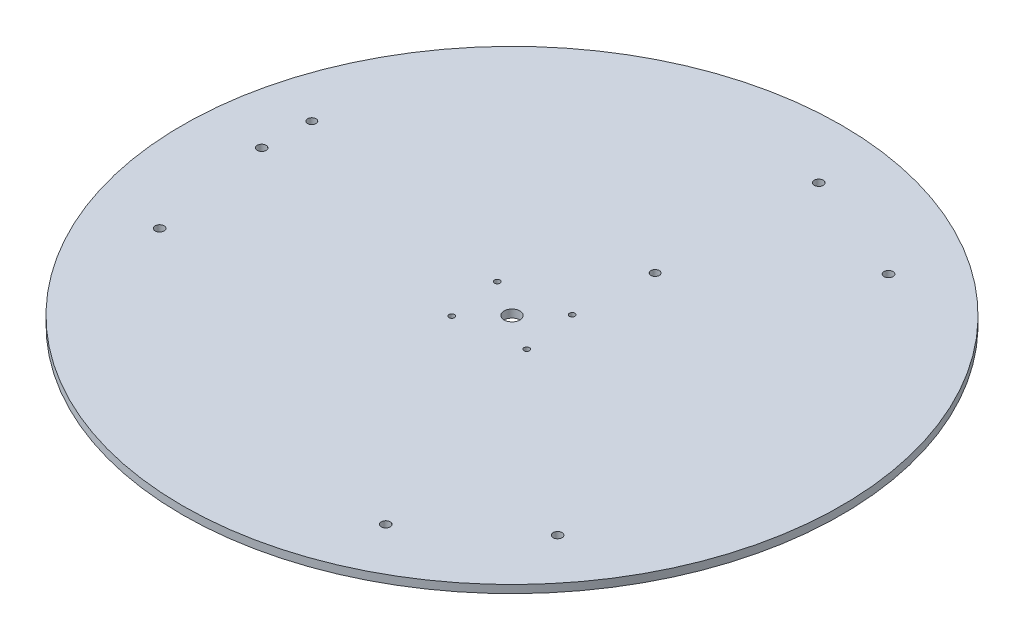
from build123d import *

# Parameters (mm, degrees)
SKETCH2_R               = 125
BOSS_EXTRUDE1_DEPTH     = 3
CUT_EXTRUDE1_DEPTH      = 62
CUT_EXTRUDE1_DEPTH_BACK = 26
SKETCH3_R               = 1.7
CUT_EXTRUDE2_DEPTH      = 55
CUT_EXTRUDE2_DEPTH_BACK = 33
SKETCH4_R               = 3
SKETCH5_R               = 1.6
CUT_EXTRUDE3_DEPTH      = 177.802149308
CUT_EXTRUDE4_REACH      = 178.802
SKETCH6_R               = 1.05


with BuildPart() as part:
    # Sketch2 → Boss-Extrude1 (new body)
    with BuildSketch(Plane(origin=(0, 0, 0), x_dir=(1, 0, 0), z_dir=(0, 1, 0))):
        Circle(SKETCH2_R)
    extrude(amount=BOSS_EXTRUDE1_DEPTH)

    # Sketch3 → Cut-Extrude1 (cut, two sides: drawn at the far end of the back side and taken through both)
    with BuildSketch(Plane(origin=(0, 3, 0), x_dir=(1, 0, 0), z_dir=(0, 1, 0)).offset(-CUT_EXTRUDE1_DEPTH_BACK)):
        with Locations((57.824361976, 84.994428132)):
            Circle(SKETCH3_R)
        with Locations((14.606066285, 101.75643704)):
            Circle(SKETCH3_R)
        with Locations((44.695152955, -92.574580495)):
            Circle(SKETCH3_R)
        with Locations((80.820626333, -63.527442972)):
            Circle(SKETCH3_R)
        with Locations((-102.519514931, 7.580152362)):
            Circle(SKETCH3_R)
        with Locations((-95.426692618, -38.228994068)):
            Circle(SKETCH3_R)
    extrude(amount=CUT_EXTRUDE1_DEPTH + CUT_EXTRUDE1_DEPTH_BACK, mode=Mode.SUBTRACT)

    # Sketch4 → Cut-Extrude2 (cut, two sides: drawn at the far end of the back side and taken through both)
    with BuildSketch(Plane(origin=(0, 3, 0), x_dir=(1, 0, 0), z_dir=(0, 1, 0)).offset(-CUT_EXTRUDE2_DEPTH_BACK)):
        Circle(SKETCH4_R)
    extrude(amount=CUT_EXTRUDE2_DEPTH + CUT_EXTRUDE2_DEPTH_BACK, mode=Mode.SUBTRACT)

    # Sketch5 → Cut-Extrude3 (cut, through all)
    with BuildSketch(Plane.XZ):
        with Locations((-101.778099897, -25.854755487)):
            Circle(SKETCH5_R)
        with Locations((13.216774043, -41.092175458)):
            Circle(SKETCH5_R)
    extrude(amount=-CUT_EXTRUDE3_DEPTH, mode=Mode.SUBTRACT)

    # Sketch6 → Cut-Extrude4 (cut, up to next)
    with BuildSketch(Plane(origin=(0, 3, 0), x_dir=(1, 0, 0), z_dir=(0, 1, 0)), mode=Mode.PRIVATE) as cut_extrude4_sk1:
        with Locations((11.198414604, 11.625148557)):
            Circle(SKETCH6_R)
    cut_extrude4_tool1 = extrude(cut_extrude4_sk1.sketch, amount=-CUT_EXTRUDE4_REACH, mode=Mode.PRIVATE) & part.part
    # Sketch6 → Cut-Extrude4 (cut, up to next)
    with BuildSketch(Plane(origin=(0, 3, 0), x_dir=(1, 0, 0), z_dir=(0, 1, 0)), mode=Mode.PRIVATE) as cut_extrude4_sk2:
        with Locations((13.889158795, -8.300914364)):
            Circle(SKETCH6_R)
    cut_extrude4_tool2 = extrude(cut_extrude4_sk2.sketch, amount=-CUT_EXTRUDE4_REACH, mode=Mode.PRIVATE) & part.part
    # Sketch6 → Cut-Extrude4 (cut, up to next)
    with BuildSketch(Plane(origin=(0, 3, 0), x_dir=(1, 0, 0), z_dir=(0, 1, 0)), mode=Mode.PRIVATE) as cut_extrude4_sk3:
        with Locations((-11.198414604, -11.625148557)):
            Circle(SKETCH6_R)
    cut_extrude4_tool3 = extrude(cut_extrude4_sk3.sketch, amount=-CUT_EXTRUDE4_REACH, mode=Mode.PRIVATE) & part.part
    # Sketch6 → Cut-Extrude4 (cut, up to next)
    with BuildSketch(Plane(origin=(0, 3, 0), x_dir=(1, 0, 0), z_dir=(0, 1, 0)), mode=Mode.PRIVATE) as cut_extrude4_sk4:
        with Locations((-13.889158795, 8.300914364)):
            Circle(SKETCH6_R)
    cut_extrude4_tool4 = extrude(cut_extrude4_sk4.sketch, amount=-CUT_EXTRUDE4_REACH, mode=Mode.PRIVATE) & part.part
    add(cut_extrude4_tool1.solids().sort_by_distance((11.198415, 3, -11.625149))[0], mode=Mode.SUBTRACT)
    add(cut_extrude4_tool2.solids().sort_by_distance((13.889159, 3, 8.300914))[0], mode=Mode.SUBTRACT)
    add(cut_extrude4_tool3.solids().sort_by_distance((-11.198415, 3, 11.625149))[0], mode=Mode.SUBTRACT)
    add(cut_extrude4_tool4.solids().sort_by_distance((-13.889159, 3, -8.300914))[0], mode=Mode.SUBTRACT)


solid = part.part
